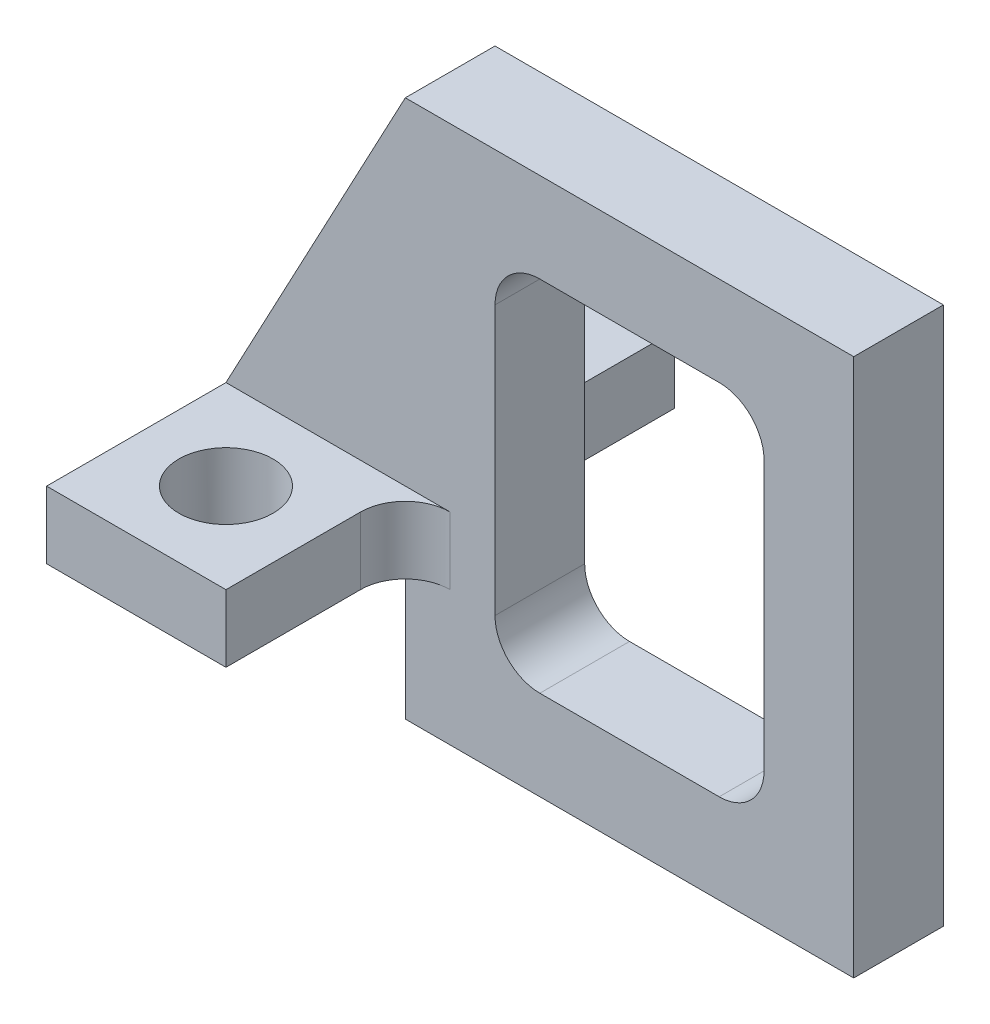
from build123d import *

# Parameters (mm, degrees)
SKETCH_1_W          = 20
SKETCH_1_H          = 24
SKETCH_1_W_2        = 12
SKETCH_1_H_2        = 16
EXTRUDE_1_DEPTH     = 4
SKETCH_2_W          = 20
SKETCH_2_H          = 3
EXTRUDE_2_DEPTH     = 8
EXTRUDE_3_DEPTH     = 4
SKETCH_4_R          = 2.1
CUT_EXTRUDE_1_DEPTH = 26
FILLET_1_R          = 2
FILLET_4_R          = 2


with BuildPart() as part:
    # 草图1 → 凸台-拉伸1 (new body)
    with BuildSketch(Plane.XY):
        with Locations((6, 8)):
            Rectangle(SKETCH_1_W, SKETCH_1_H)
        with Locations((6, 8)):
            Rectangle(SKETCH_1_W_2, SKETCH_1_H_2, mode=Mode.SUBTRACT)
    extrude(amount=EXTRUDE_1_DEPTH)

    # 草图2 → 凸台-拉伸2 (add)
    with BuildSketch(Plane.ZY.offset(4)):
        with Locations((2, 3.5)):
            Rectangle(SKETCH_2_W, SKETCH_2_H)
    extrude(amount=EXTRUDE_2_DEPTH)

    # 草图3 → 凸台-拉伸3 (add)
    with BuildSketch(Plane.XY.offset(4)):
        Polygon((-12, 5), (-4, 20), (-4, 5), align=None)
    extrude(amount=-EXTRUDE_3_DEPTH)

    # 草图4 → 切除-拉伸1 (cut, through all)
    with BuildSketch(Plane(origin=(0, 5, 0), x_dir=(1, 0, 0), z_dir=(0, 1, 0))):
        with Locations((-8, 4)):
            Circle(SKETCH_4_R)
        with Locations((-8, -8)):
            Circle(SKETCH_4_R)
    extrude(amount=-CUT_EXTRUDE_1_DEPTH, mode=Mode.SUBTRACT)

    # 圆角1
    fillet_1_edges = [part.edges().sort_by_distance(p)[0] for p in [
        (0, 16, 2),
        (12, 16, 2),
        (12, 0, 2),
        (0, 0, 2),
    ]]
    fillet(fillet_1_edges, radius=FILLET_1_R)

    # 圆角4
    fillet_4_edges = [part.edges().sort_by_distance(p)[0] for p in [
        (-4, 3.5, 4),
        (-4, 3.5, 0),
    ]]
    fillet(fillet_4_edges, radius=FILLET_4_R)


solid = part.part
